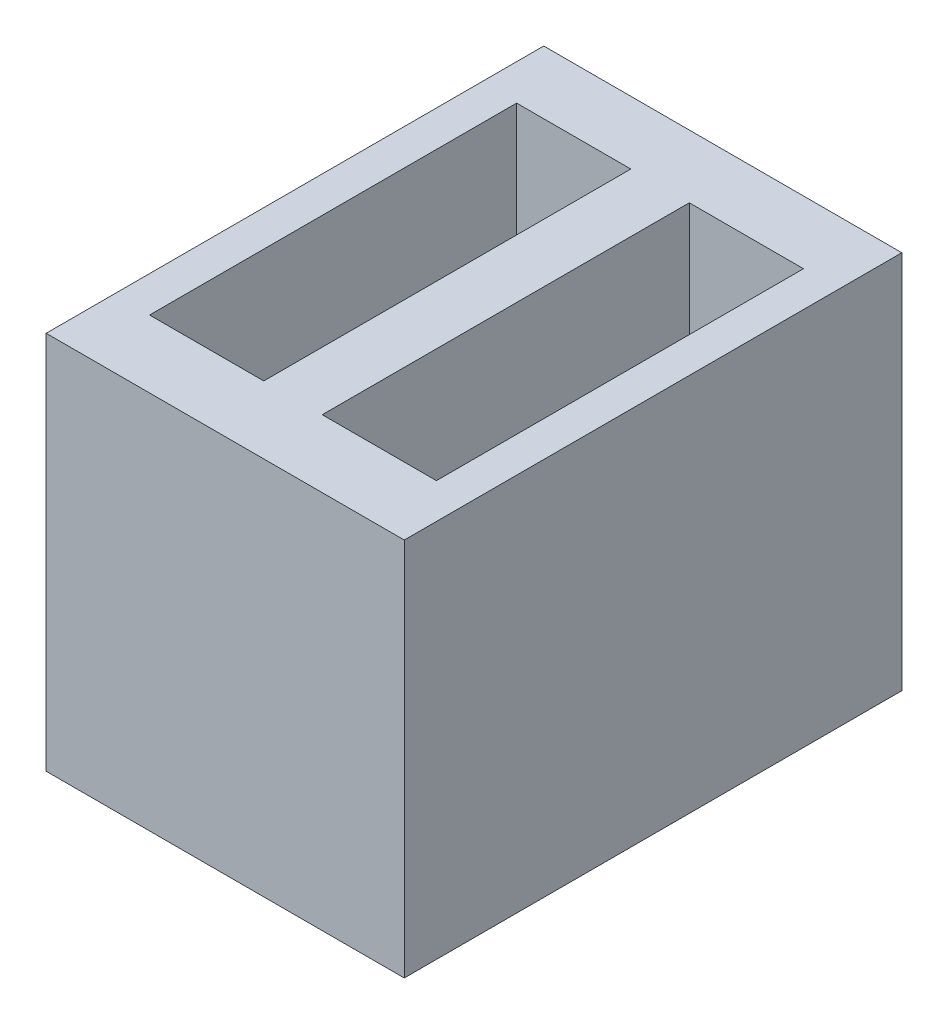
from build123d import *

# Parameters (mm, degrees)
CROQUIS1_W              = 4.39
CROQUIS1_H              = 6.1
SALIENTE_EXTRUIR1_DEPTH = 4.65
CROQUIS3_W              = 1.4
CROQUIS3_H              = 4.5
CORTAR_EXTRUIR1_DEPTH   = 9.837680691


with BuildPart() as part:
    # Croquis1 → Saliente-Extruir1 (new body)
    with BuildSketch(Plane(origin=(0, 0, 0), x_dir=(1, 0, 0), z_dir=(0, 1, 0))):
        with Locations((2.195, 3.05)):
            Rectangle(CROQUIS1_W, CROQUIS1_H)
    extrude(amount=SALIENTE_EXTRUIR1_DEPTH)

    # Croquis3 → Cortar-Extruir1 (cut, through all)
    with BuildSketch(Plane(origin=(0, 4.65, 0), x_dir=(1, 0, 0), z_dir=(0, 1, 0))):
        with Locations((1.14, 3.077612144)):
            Rectangle(CROQUIS3_W, CROQUIS3_H)
        with Locations((3.256764551, 3.077612144)):
            Rectangle(CROQUIS3_W, CROQUIS3_H)
    extrude(amount=-CORTAR_EXTRUIR1_DEPTH, mode=Mode.SUBTRACT)


solid = part.part
